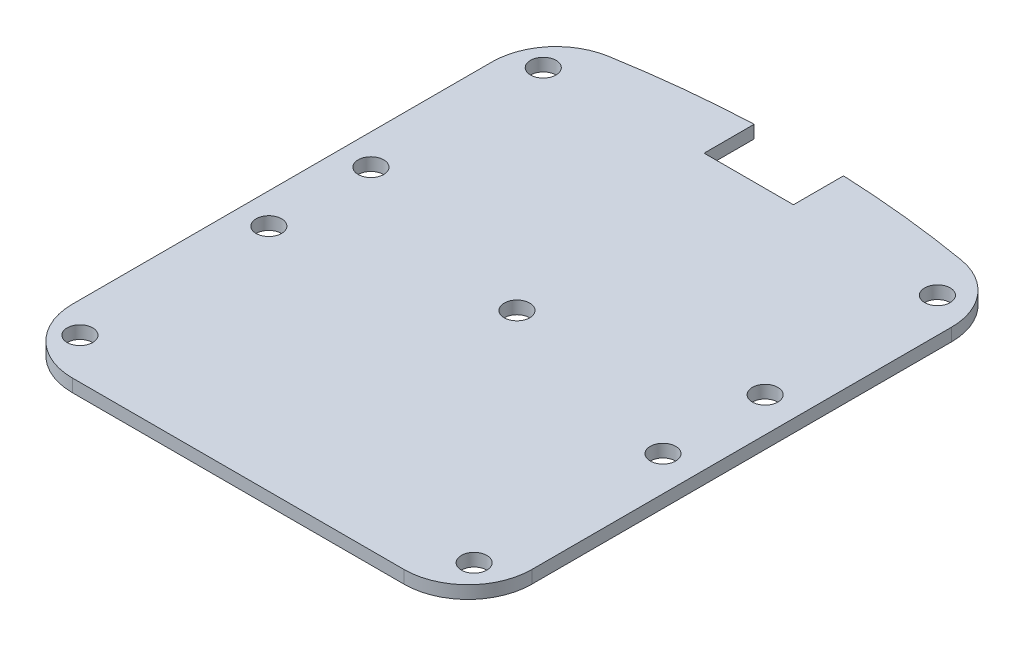
from build123d import *

# Parameters (mm, degrees)
BOSS_EXTRUDE1_DEPTH = 5
SKETCH5_R           = 5
CUT_EXTRUDE2_DEPTH  = 10
SKETCH6_W           = 80
SKETCH6_H           = 80
SKETCH6_W_2         = 95
SKETCH6_H_2         = 95
BOSS_EXTRUDE2_DEPTH = 1
SKETCH7_W           = 35
SKETCH7_H           = 31.403173323
CUT_EXTRUDE3_DEPTH  = 10


with BuildPart() as part:
    # Sketch1 → Boss-Extrude1 (new body)
    with BuildSketch(Plane(origin=(0, 0, 0), x_dir=(1, 0, 0), z_dir=(0, 1, 0))):
        with BuildLine():
            ThreePointArc((-89.202352286, -85), (-81.880021816, -102.67766953), (-64.202352286, -110))
            Line((-64.202352286, -110), (65.797647714, -110))
            ThreePointArc((65.797647714, -110), (83.475317244, -102.67766953), (90.797647714, -85))
            Line((90.797647714, -85), (90.797647714, -35))
            Line((90.797647714, -35), (90.797647714, 31.47331922))
            Line((90.797647714, 31.47331922), (90.797647714, 79.461679372))
            ThreePointArc((90.797647714, 79.461679372), (84.910138891, 95.577283021), (70.020633234, 104.102425978))
            ThreePointArc((70.020633234, 104.102425978), (0.80038099, 109.994179998), (-68.420925207, 104.11482166))
            ThreePointArc((-68.420925207, 104.11482166), (-83.313400439, 95.590634086), (-89.202352286, 79.47331922))
            Line((-89.202352286, 79.47331922), (-89.202352286, 31.47331922))
            Line((-89.202352286, 31.47331922), (-89.202352286, -35))
            Line((-89.202352286, -35), (-89.202352286, -85))
        make_face()
    extrude(amount=BOSS_EXTRUDE1_DEPTH)

    # Sketch5 → Cut-Extrude2 (cut)
    with BuildSketch(Plane(origin=(0, 5, 0), x_dir=(1, 0, 0), z_dir=(0, 1, 0))):
        with Locations((-77.202352286, 20)):
            Circle(SKETCH5_R)
        with Locations((-77.202352286, -20)):
            Circle(SKETCH5_R)
        with Locations((-77.202352286, 87.5)):
            Circle(SKETCH5_R)
        with Locations((-77.202352286, -94)):
            Circle(SKETCH5_R)
        Circle(SKETCH5_R)
        with Locations((77.202352286, -94)):
            Circle(SKETCH5_R)
        with Locations((77.202352286, -20)):
            Circle(SKETCH5_R)
        with Locations((77.202352286, 20)):
            Circle(SKETCH5_R)
        with Locations((77.202352286, 87.5)):
            Circle(SKETCH5_R)
    extrude(amount=-CUT_EXTRUDE2_DEPTH, mode=Mode.SUBTRACT)

    # Sketch6 → Boss-Extrude2 (add)
    with BuildSketch(Plane.XZ):
        with Locations((0, -50)):
            Rectangle(SKETCH6_W, SKETCH6_H)
        with Locations((0, 60)):
            Rectangle(SKETCH6_W_2, SKETCH6_H_2)
    extrude(amount=BOSS_EXTRUDE2_DEPTH)

    # Sketch7 → Cut-Extrude3 (cut)
    with BuildSketch(Plane.XZ):
        with Locations((0.80038099, -105.701586662)):
            Rectangle(SKETCH7_W, SKETCH7_H)
    extrude(amount=-CUT_EXTRUDE3_DEPTH, mode=Mode.SUBTRACT)


solid = part.part
